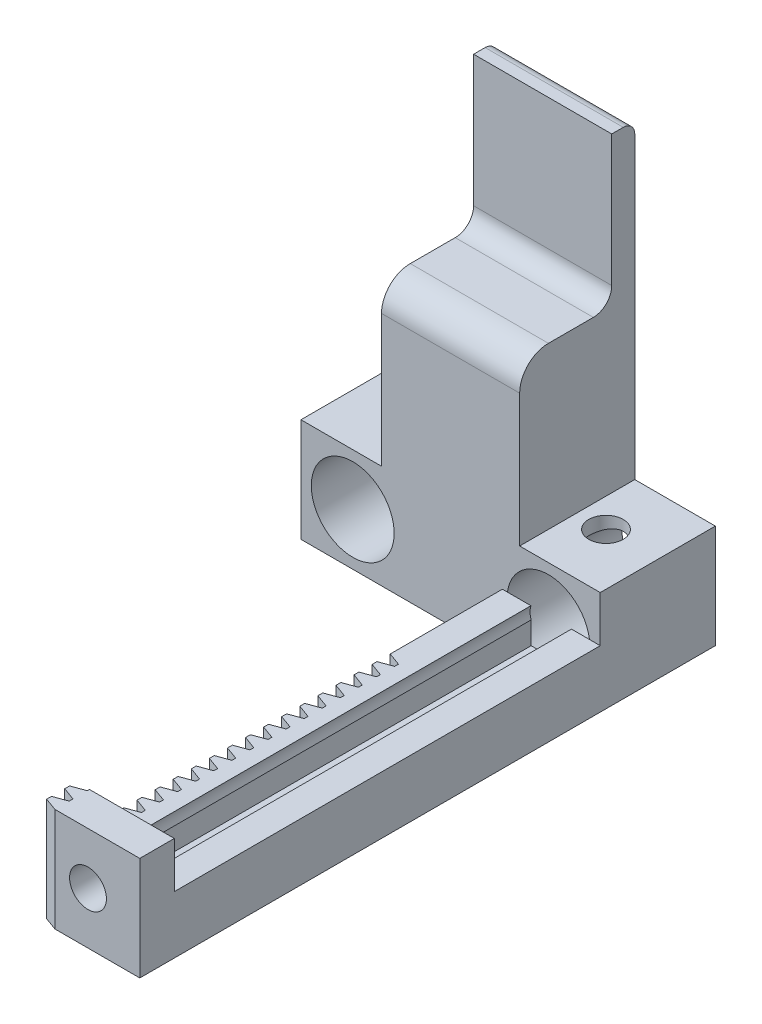
from build123d import *

# Parameters (mm, degrees)
SKETCH_1_W             = 26
SKETCH_1_H             = 9
EXTRUDE_1_DEPTH        = 10
SKETCH_2_R             = 3.6
CUT_EXTRUDE_1_DEPTH    = 18.007351352
EXTRUDE_2_DEPTH        = 26
CUT_EXTRUDE_2_DEPTH    = 7
SKETCH_7_W             = 8.5
SKETCH_7_H             = 9
EXTRUDE_3_DEPTH        = 40
SKETCH_8_R             = 1.6
CUT_EXTRUDE_3_DEPTH    = 40
SKETCH_9_W             = 3.5
SKETCH_9_H             = 37
CUT_EXTRUDE_4_DEPTH    = 7
CUT_EXTRUDE_12_DEPTH   = 50.979995998
PATTERN_START          = -4.5
PATTERN_LINEAR_2_DEPTH = 9
SKETCH_22_W            = 8.5
SKETCH_22_H            = 37
CUT_EXTRUDE_13_DEPTH   = 4
SKETCH_23_R            = 1.5
CUT_EXTRUDE_14_DEPTH   = 4


# Read off the part's stored shape, not the designer's step: 阵列(线性)2
with BuildPart() as part:
    # 草图1 → 凸台-拉伸1 (new body)
    with BuildSketch(Plane.XY):
        Rectangle(SKETCH_1_W, SKETCH_1_H)
    extrude(amount=-EXTRUDE_1_DEPTH)

    # 草图2 → 切除-拉伸1 (cut, through all)
    with BuildSketch(Plane.XY):
        with Locations((8.5, 0)):
            Circle(SKETCH_2_R)
        with Locations(Location((-8.5, 0, 0), (0, 0, 180))):
            Circle(SKETCH_2_R)
    extrude(amount=-CUT_EXTRUDE_1_DEPTH, mode=Mode.SUBTRACT)

    # 草图5 → 凸台-拉伸2 (add, through all)
    with BuildSketch(Plane.ZY.offset(13)):
        with BuildLine():
            Line((0, 4.5), (-10, 4.5))
            Line((-10, 4.5), (-10, 8.301419967))
            Line((-10, 8.301419967), (-10, 30.5))
            ThreePointArc((-10, 30.5), (-9.707106781, 31.207106781), (-9, 31.5))
            Line((-9, 31.5), (-8, 31.5))
            Line((-8, 31.5), (-8, 20.1))
            ThreePointArc((-8, 20.1), (-7.53137085, 18.96862915), (-6.4, 18.5))
            Line((-6.4, 18.5), (-2.5, 18.5))
            ThreePointArc((-2.5, 18.5), (-0.732233047, 17.767766953), (0, 16))
            Line((0, 16), (0, 4.5))
        make_face()
    extrude(amount=-EXTRUDE_2_DEPTH)

    # 草图5<2> → 切除-拉伸2 (cut)
    with BuildSketch(Plane.ZY.offset(13)):
        with BuildLine():
            Line((0, 4.5), (-10, 4.5))
            Line((-10, 4.5), (-10, 8.301419967))
            Line((-10, 8.301419967), (-10, 30.5))
            ThreePointArc((-10, 30.5), (-9.707106781, 31.207106781), (-9, 31.5))
            Line((-9, 31.5), (-8, 31.5))
            Line((-8, 31.5), (-8, 20.1))
            ThreePointArc((-8, 20.1), (-7.53137085, 18.96862915), (-6.4, 18.5))
            Line((-6.4, 18.5), (-2.5, 18.5))
            ThreePointArc((-2.5, 18.5), (-0.732233047, 17.767766953), (0, 16))
            Line((0, 16), (0, 4.5))
        make_face()
    cut_extrude_2 = extrude(amount=-CUT_EXTRUDE_2_DEPTH, mode=Mode.SUBTRACT)

    # 镜向1: 切除-拉伸2 across plane
    add(cut_extrude_2.mirror(Plane(origin=(0, 0, 0), x_dir=(0, 0, 1), z_dir=(1, 0, 0))), mode=Mode.SUBTRACT)

    # 草图7 → 凸台-拉伸3 (add)
    with BuildSketch(Plane.XY):
        with Locations((8.75, 0)):
            Rectangle(SKETCH_7_W, SKETCH_7_H)
    extrude(amount=EXTRUDE_3_DEPTH)

    # 草图8 → 切除-拉伸3 (cut)
    with BuildSketch(Plane.XY.offset(40)):
        with Locations((8.5, 0)):
            Circle(SKETCH_8_R)
    extrude(amount=-CUT_EXTRUDE_3_DEPTH, mode=Mode.SUBTRACT)

    # 草图9 → 切除-拉伸4 (cut)
    with BuildSketch(Plane(origin=(0, 4.5, 0), x_dir=(1, 0, 0), z_dir=(0, 1, 0))):
        with Locations((8.75, -18.5)):
            Rectangle(SKETCH_9_W, SKETCH_9_H)
    extrude(amount=-CUT_EXTRUDE_4_DEPTH, mode=Mode.SUBTRACT)

    # 草图10 → 切除-拉伸12 (cut, through all)
    with BuildSketch(Plane(origin=(0, 4.5, 0), x_dir=(1, 0, 0), z_dir=(0, 1, 0))):
        Polygon((5.625, -40), (5.625, -40.330435371), (4.5, -40.739901884), (4.5, -39.590533486), align=None)
    extrude(amount=-CUT_EXTRUDE_12_DEPTH, mode=Mode.SUBTRACT)

    # 阵列(线性)2 outline → 阵列(线性)2 (cut)
    with BuildSketch(Plane(origin=(0, 0, 0), x_dir=(1, 0, 0), z_dir=(0, 1, 0)).offset(PATTERN_START)):
        Polygon((5.625, -10.485305161), (5.625, -10.154869791), (4.5, -9.745403277), (4.5, -10.894771675), align=None)
        Polygon((5.625, -38.429203673), (4.5, -38.01973716), (4.5, -39.169105557), (5.625, -38.759639044), align=None)
        Polygon((5.625, -36.858407346), (4.5, -36.448940833), (4.5, -37.598309231), (5.625, -37.188842717), align=None)
        Polygon((5.625, -35.28761102), (4.5, -34.878144506), (4.5, -36.027512904), (5.625, -35.61804639), align=None)
        Polygon((5.625, -33.716814693), (4.5, -33.307348179), (4.5, -34.456716577), (5.625, -34.047250063), align=None)
        Polygon((5.625, -32.146018366), (4.5, -31.736551852), (4.5, -32.88592025), (5.625, -32.476453737), align=None)
        Polygon((5.625, -30.575222039), (4.5, -30.165755526), (4.5, -31.315123923), (5.625, -30.90565741), align=None)
        Polygon((5.625, -29.004425712), (4.5, -28.594959199), (4.5, -29.744327597), (5.625, -29.334861083), align=None)
        Polygon((5.625, -27.433629386), (4.5, -27.024162872), (4.5, -28.17353127), (5.625, -27.764064756), align=None)
        Polygon((5.625, -25.862833059), (4.5, -25.453366545), (4.5, -26.602734943), (5.625, -26.193268429), align=None)
        Polygon((5.625, -24.292036732), (4.5, -23.882570219), (4.5, -25.031938616), (5.625, -24.622472103), align=None)
        Polygon((5.625, -22.721240405), (4.5, -22.311773892), (4.5, -23.461142289), (5.625, -23.051675776), align=None)
        Polygon((5.625, -21.150444078), (4.5, -20.740977565), (4.5, -21.890345963), (5.625, -21.480879449), align=None)
        Polygon((5.625, -19.579647752), (4.5, -19.170181238), (4.5, -20.319549636), (5.625, -19.910083122), align=None)
        Polygon((5.625, -18.008851425), (4.5, -17.599384911), (4.5, -18.748753309), (5.625, -18.339286795), align=None)
        Polygon((5.625, -16.438055098), (4.5, -16.028588585), (4.5, -17.177956982), (5.625, -16.768490469), align=None)
        Polygon((5.625, -14.867258771), (4.5, -14.457792258), (4.5, -15.607160655), (5.625, -15.197694142), align=None)
        Polygon((5.625, -13.296462444), (4.5, -12.886995931), (4.5, -14.036364329), (5.625, -13.626897815), align=None)
        Polygon((5.625, -11.725666118), (4.5, -11.316199604), (4.5, -12.465568002), (5.625, -12.056101488), align=None)
    extrude(amount=PATTERN_LINEAR_2_DEPTH, mode=Mode.SUBTRACT)

    # 草图22 → 切除-拉伸13 (cut)
    with BuildSketch(Plane(origin=(0, 4.5, 0), x_dir=(1, 0, 0), z_dir=(0, 1, 0))):
        with Locations((8.75, -18.5)):
            Rectangle(SKETCH_22_W, SKETCH_22_H)
    extrude(amount=-CUT_EXTRUDE_13_DEPTH, mode=Mode.SUBTRACT)

    # 草图23 → 切除-拉伸14 (cut)
    with BuildSketch(Plane(origin=(0, 4.5, 0), x_dir=(1, 0, 0), z_dir=(0, 1, 0))):
        with Locations(Location((8.5, 5, 0), (0, 0, 270))):
            Circle(SKETCH_23_R)
        with Locations(Location((-8.5, 5, 0), (0, 0, 270))):
            Circle(SKETCH_23_R)
    extrude(amount=-CUT_EXTRUDE_14_DEPTH, mode=Mode.SUBTRACT)


solid = part.part
